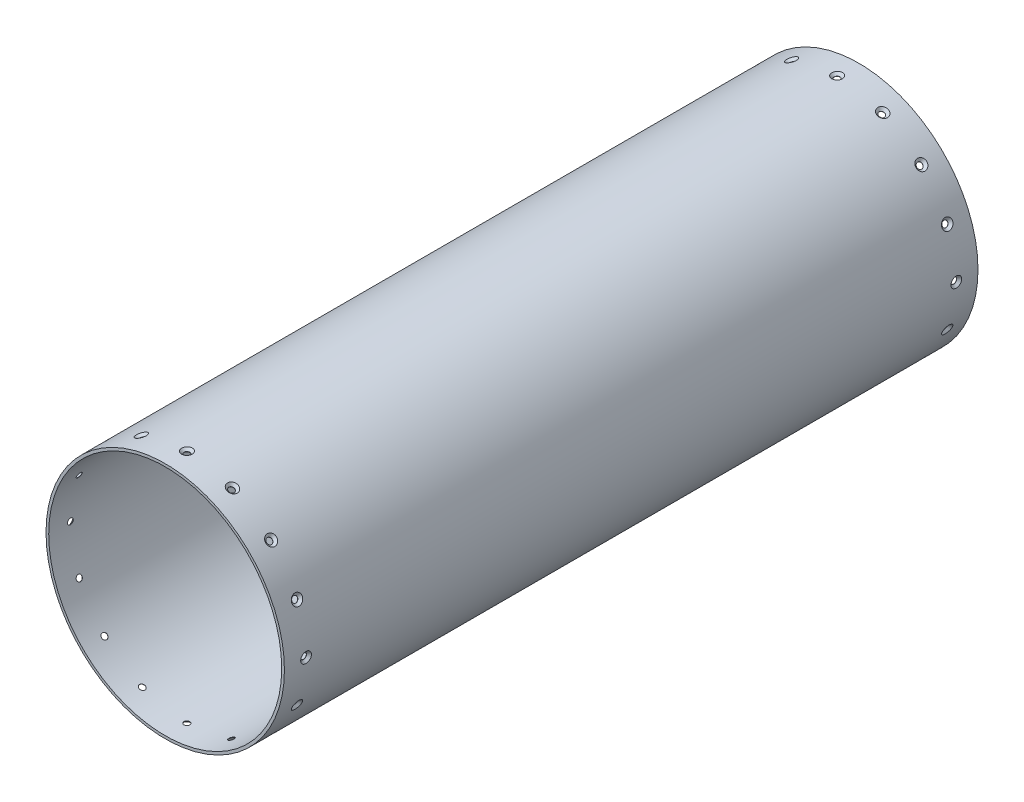
from build123d import *

# Parameters (mm, degrees)
SKETCH1_R                                       = 69.85
SKETCH1_R_2                                     = 68.2625
EXTRUDE1_DEPTH                                  = 406.4
CSK_FOR_M3_FLAT_HEAD_MACHINE_SCREW1_D           = 3.4
CSK_FOR_M3_FLAT_HEAD_MACHINE_SCREW1_CSINK_D     = 6.3
CSK_FOR_M3_FLAT_HEAD_MACHINE_SCREW1_CSINK_ANGLE = 90
CIRPATTERN1_COUNT                               = 16
LPATTERN1_COPY_1_D                              = 3.4
LPATTERN1_COPY_1_CSINK_D                        = 6.3
LPATTERN1_COPY_1_CSINK_ANGLE                    = 90
LPATTERN1_COPY_2_D                              = 3.4
LPATTERN1_COPY_2_CSINK_D                        = 6.3
LPATTERN1_COPY_2_CSINK_ANGLE                    = 90
LPATTERN1_COPY_3_D                              = 3.4
LPATTERN1_COPY_3_CSINK_D                        = 6.3
LPATTERN1_COPY_3_CSINK_ANGLE                    = 90
LPATTERN1_COPY_4_D                              = 3.4
LPATTERN1_COPY_4_CSINK_D                        = 6.3
LPATTERN1_COPY_4_CSINK_ANGLE                    = 90
LPATTERN1_COPY_5_D                              = 3.4
LPATTERN1_COPY_5_CSINK_D                        = 6.3
LPATTERN1_COPY_5_CSINK_ANGLE                    = 90
LPATTERN1_COPY_6_D                              = 3.4
LPATTERN1_COPY_6_CSINK_D                        = 6.3
LPATTERN1_COPY_6_CSINK_ANGLE                    = 90
LPATTERN1_COPY_7_D                              = 3.4
LPATTERN1_COPY_7_CSINK_D                        = 6.3
LPATTERN1_COPY_7_CSINK_ANGLE                    = 90
LPATTERN1_COPY_8_D                              = 3.4
LPATTERN1_COPY_8_CSINK_D                        = 6.3
LPATTERN1_COPY_8_CSINK_ANGLE                    = 90
LPATTERN1_COPY_9_D                              = 3.4
LPATTERN1_COPY_9_CSINK_D                        = 6.3
LPATTERN1_COPY_9_CSINK_ANGLE                    = 90
LPATTERN1_COPY_10_D                             = 3.4
LPATTERN1_COPY_10_CSINK_D                       = 6.3
LPATTERN1_COPY_10_CSINK_ANGLE                   = 90
LPATTERN1_COPY_11_D                             = 3.4
LPATTERN1_COPY_11_CSINK_D                       = 6.3
LPATTERN1_COPY_11_CSINK_ANGLE                   = 90
LPATTERN1_COPY_12_D                             = 3.4
LPATTERN1_COPY_12_CSINK_D                       = 6.3
LPATTERN1_COPY_12_CSINK_ANGLE                   = 90
LPATTERN1_COPY_13_D                             = 3.4
LPATTERN1_COPY_13_CSINK_D                       = 6.3
LPATTERN1_COPY_13_CSINK_ANGLE                   = 90
LPATTERN1_COPY_14_D                             = 3.4
LPATTERN1_COPY_14_CSINK_D                       = 6.3
LPATTERN1_COPY_14_CSINK_ANGLE                   = 90
LPATTERN1_COPY_15_D                             = 3.4
LPATTERN1_COPY_15_CSINK_D                       = 6.3
LPATTERN1_COPY_15_CSINK_ANGLE                   = 90
LPATTERN1_COPY_16_D                             = 3.4
LPATTERN1_COPY_16_CSINK_D                       = 6.3
LPATTERN1_COPY_16_CSINK_ANGLE                   = 90


with BuildPart() as part:
    # Sketch1 → Extrude1 (new body)
    with BuildSketch(Plane.XY):
        Circle(SKETCH1_R)
        Circle(SKETCH1_R_2, mode=Mode.SUBTRACT)
    extrude(amount=EXTRUDE1_DEPTH)

    # CSK for M3 Flat Head Machine Screw1 (through all)
    with Locations(Plane(origin=(0, -69.85, 12.7), x_dir=(1, 0, 0), z_dir=(0, -1, 0))):
        with Locations((0, 0)):
            csk_for_m3_flat_head_machine_screw1 = CounterSinkHole(CSK_FOR_M3_FLAT_HEAD_MACHINE_SCREW1_D / 2, CSK_FOR_M3_FLAT_HEAD_MACHINE_SCREW1_CSINK_D / 2, counter_sink_angle=CSK_FOR_M3_FLAT_HEAD_MACHINE_SCREW1_CSINK_ANGLE)

    # CirPattern1: CSK for M3 Flat Head Machine Screw1 ×16 about axis
    cirpattern1_axis = Axis((0, 0, 406.4), (0, 0, -1))
    for i in range(1, CIRPATTERN1_COUNT):
        add(csk_for_m3_flat_head_machine_screw1.rotate(cirpattern1_axis, i * 360 / CIRPATTERN1_COUNT), mode=Mode.SUBTRACT)

    # LPattern1 copy 1 (through all)
    with Locations(Plane(origin=(-26.730437751, -64.532985346, 393.7), x_dir=(0.9238795325112867, -0.3826834323650898, 0), z_dir=(-0.3826834323650898, -0.9238795325112867, 0))):
        with Locations((0, 0)):
            CounterSinkHole(LPATTERN1_COPY_1_D / 2, LPATTERN1_COPY_1_CSINK_D / 2, counter_sink_angle=LPATTERN1_COPY_1_CSINK_ANGLE)

    # LPattern1 copy 2 (through all)
    with Locations(Plane(origin=(-49.391408666, -49.391408666, 393.7), x_dir=(0.7071067811865476, -0.7071067811865475, 0), z_dir=(-0.7071067811865475, -0.7071067811865476, 0))):
        with Locations((0, 0)):
            CounterSinkHole(LPATTERN1_COPY_2_D / 2, LPATTERN1_COPY_2_CSINK_D / 2, counter_sink_angle=LPATTERN1_COPY_2_CSINK_ANGLE)

    # LPattern1 copy 3 (through all)
    with Locations(Plane(origin=(-64.532985346, -26.730437751, 393.7), x_dir=(0.38268343236508984, -0.9238795325112867, 0), z_dir=(-0.9238795325112867, -0.38268343236508984, 0))):
        with Locations((0, 0)):
            CounterSinkHole(LPATTERN1_COPY_3_D / 2, LPATTERN1_COPY_3_CSINK_D / 2, counter_sink_angle=LPATTERN1_COPY_3_CSINK_ANGLE)

    # LPattern1 copy 4 (through all)
    with Locations(Plane(origin=(-69.85, 0, 393.7), x_dir=(0, -1, 0), z_dir=(-1, 0, 0))):
        with Locations((0, 0)):
            CounterSinkHole(LPATTERN1_COPY_4_D / 2, LPATTERN1_COPY_4_CSINK_D / 2, counter_sink_angle=LPATTERN1_COPY_4_CSINK_ANGLE)

    # LPattern1 copy 5 (through all)
    with Locations(Plane(origin=(-64.532985346, 26.730437751, 393.7), x_dir=(-0.3826834323650897, -0.9238795325112867, 0), z_dir=(-0.9238795325112867, 0.3826834323650897, 0))):
        with Locations((0, 0)):
            CounterSinkHole(LPATTERN1_COPY_5_D / 2, LPATTERN1_COPY_5_CSINK_D / 2, counter_sink_angle=LPATTERN1_COPY_5_CSINK_ANGLE)

    # LPattern1 copy 6 (through all)
    with Locations(Plane(origin=(-49.391408666, 49.391408666, 393.7), x_dir=(-0.7071067811865475, -0.7071067811865476, 0), z_dir=(-0.7071067811865476, 0.7071067811865475, 0))):
        with Locations((0, 0)):
            CounterSinkHole(LPATTERN1_COPY_6_D / 2, LPATTERN1_COPY_6_CSINK_D / 2, counter_sink_angle=LPATTERN1_COPY_6_CSINK_ANGLE)

    # LPattern1 copy 7 (through all)
    with Locations(Plane(origin=(-26.730437751, 64.532985346, 393.7), x_dir=(-0.9238795325112867, -0.3826834323650899, 0), z_dir=(-0.3826834323650899, 0.9238795325112867, 0))):
        with Locations((0, 0)):
            CounterSinkHole(LPATTERN1_COPY_7_D / 2, LPATTERN1_COPY_7_CSINK_D / 2, counter_sink_angle=LPATTERN1_COPY_7_CSINK_ANGLE)

    # LPattern1 copy 8 (through all)
    with Locations(Plane(origin=(0, 69.85, 393.7), x_dir=(-1, 0, 0), z_dir=(0, 1, 0))):
        with Locations((0, 0)):
            CounterSinkHole(LPATTERN1_COPY_8_D / 2, LPATTERN1_COPY_8_CSINK_D / 2, counter_sink_angle=LPATTERN1_COPY_8_CSINK_ANGLE)

    # LPattern1 copy 9 (through all)
    with Locations(Plane(origin=(26.730437751, 64.532985346, 393.7), x_dir=(-0.9238795325112868, 0.38268343236508967, 0), z_dir=(0.38268343236508967, 0.9238795325112868, 0))):
        with Locations((0, 0)):
            CounterSinkHole(LPATTERN1_COPY_9_D / 2, LPATTERN1_COPY_9_CSINK_D / 2, counter_sink_angle=LPATTERN1_COPY_9_CSINK_ANGLE)

    # LPattern1 copy 10 (through all)
    with Locations(Plane(origin=(49.391408666, 49.391408666, 393.7), x_dir=(-0.7071067811865477, 0.7071067811865475, 0), z_dir=(0.7071067811865475, 0.7071067811865477, 0))):
        with Locations((0, 0)):
            CounterSinkHole(LPATTERN1_COPY_10_D / 2, LPATTERN1_COPY_10_CSINK_D / 2, counter_sink_angle=LPATTERN1_COPY_10_CSINK_ANGLE)

    # LPattern1 copy 11 (through all)
    with Locations(Plane(origin=(64.532985346, 26.730437751, 393.7), x_dir=(-0.3826834323650895, 0.9238795325112868, 0), z_dir=(0.9238795325112868, 0.3826834323650895, 0))):
        with Locations((0, 0)):
            CounterSinkHole(LPATTERN1_COPY_11_D / 2, LPATTERN1_COPY_11_CSINK_D / 2, counter_sink_angle=LPATTERN1_COPY_11_CSINK_ANGLE)

    # LPattern1 copy 12 (through all)
    with Locations(Plane(origin=(69.85, 0, 393.7), x_dir=(0, 1, 0), z_dir=(1, 0, 0))):
        with Locations((0, 0)):
            CounterSinkHole(LPATTERN1_COPY_12_D / 2, LPATTERN1_COPY_12_CSINK_D / 2, counter_sink_angle=LPATTERN1_COPY_12_CSINK_ANGLE)

    # LPattern1 copy 13 (through all)
    with Locations(Plane(origin=(64.532985346, -26.730437751, 393.7), x_dir=(0.38268343236509, 0.9238795325112866, 0), z_dir=(0.9238795325112866, -0.38268343236509, 0))):
        with Locations((0, 0)):
            CounterSinkHole(LPATTERN1_COPY_13_D / 2, LPATTERN1_COPY_13_CSINK_D / 2, counter_sink_angle=LPATTERN1_COPY_13_CSINK_ANGLE)

    # LPattern1 copy 14 (through all)
    with Locations(Plane(origin=(49.391408666, -49.391408666, 393.7), x_dir=(0.7071067811865474, 0.7071067811865477, 0), z_dir=(0.7071067811865477, -0.7071067811865474, 0))):
        with Locations((0, 0)):
            CounterSinkHole(LPATTERN1_COPY_14_D / 2, LPATTERN1_COPY_14_CSINK_D / 2, counter_sink_angle=LPATTERN1_COPY_14_CSINK_ANGLE)

    # LPattern1 copy 15 (through all)
    with Locations(Plane(origin=(26.730437751, -64.532985346, 393.7), x_dir=(0.9238795325112868, 0.38268343236508956, 0), z_dir=(0.38268343236508956, -0.9238795325112868, 0))):
        with Locations((0, 0)):
            CounterSinkHole(LPATTERN1_COPY_15_D / 2, LPATTERN1_COPY_15_CSINK_D / 2, counter_sink_angle=LPATTERN1_COPY_15_CSINK_ANGLE)

    # LPattern1 copy 16 (through all)
    with Locations(Plane(origin=(0, -69.85, 393.7), x_dir=(1, 0, 0), z_dir=(0, -1, 0))):
        with Locations((0, 0)):
            CounterSinkHole(LPATTERN1_COPY_16_D / 2, LPATTERN1_COPY_16_CSINK_D / 2, counter_sink_angle=LPATTERN1_COPY_16_CSINK_ANGLE)


solid = part.part
